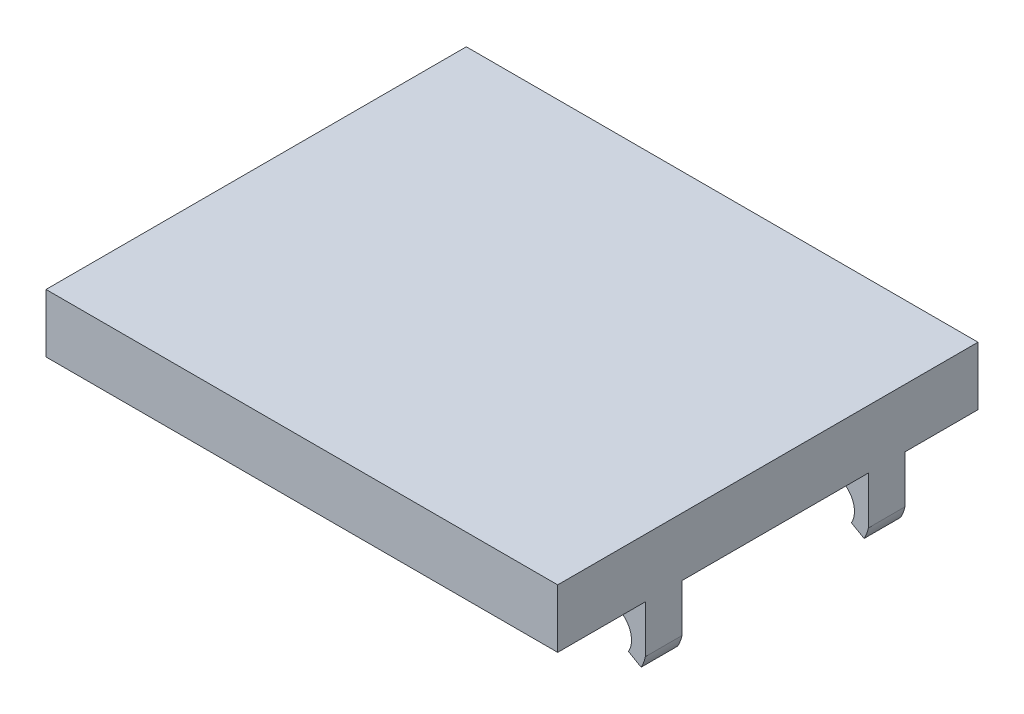
from build123d import *

# Parameters (mm, degrees)
SKETCH1_W           = 70
SKETCH1_H           = 57.5
BOSS_EXTRUDE1_DEPTH = 8
BOSS_EXTRUDE2_START = -10
SKETCH3_R           = 3.1
BOSS_EXTRUDE2_DEPTH = 5
CUT_EXTRUDE1_DEPTH  = 63


with BuildPart() as part:
    # Sketch1 → Boss-Extrude1 (new body)
    with BuildSketch(Plane(origin=(0, 1.4, 0), x_dir=(1, 0, 0), z_dir=(0, 1, 0))):
        with Locations((0, 12.22)):
            Rectangle(SKETCH1_W, SKETCH1_H)
    extrude(amount=BOSS_EXTRUDE1_DEPTH)

    # Sketch3 → Boss-Extrude2 (add)
    # profile 1 of 2: a face of its own
    with BuildSketch(Plane(origin=(0, 0, -40.97), x_dir=(-1, 0, 0), z_dir=(0, 0, -1)).offset(BOSS_EXTRUDE2_START)):
        with BuildLine():
            Line((-24.9, 1.4), (-35, 1.4))
            Line((-35, 1.4), (-35, -5.104987562))
            ThreePointArc((-35, -5.104987562), (-29.495024753, -9.174938423), (-24.9, -4.1))
            Line((-24.9, -4.1), (-24.9, 1.4))
        make_face()
        with Locations((-30, -4.1)):
            Circle(SKETCH3_R, mode=Mode.SUBTRACT)
    # profile 2 of 2: a face of its own
    with BuildSketch(Plane(origin=(0, 0, -40.97), x_dir=(-1, 0, 0), z_dir=(0, 0, -1)).offset(BOSS_EXTRUDE2_START)):
        with BuildLine():
            Line((35, 1.4), (24.9, 1.4))
            Line((24.9, 1.4), (24.9, -4.1))
            ThreePointArc((24.9, -4.1), (29.495024753, -9.174938423), (35, -5.104987562))
            Line((35, -5.104987562), (35, 1.4))
        make_face()
        with Locations((30, -4.1)):
            Circle(SKETCH3_R, mode=Mode.SUBTRACT)
    boss_extrude2 = extrude(amount=-BOSS_EXTRUDE2_DEPTH)

    # Mirror1: Boss-Extrude2 across plane
    add(boss_extrude2.mirror(Plane.XY.offset(-13.22)))

    # Sketch4 → Cut-Extrude1 (cut)
    with BuildSketch(Plane.XY.offset(-30.97)):
        Polygon((30, -4.1), (40, -9.873502692), (20, -9.873502692), align=None)
        Polygon((-40, -9.873502692), (-20, -9.873502692), (-30, -4.1), align=None)
    extrude(amount=CUT_EXTRUDE1_DEPTH, mode=Mode.SUBTRACT)


solid = part.part
